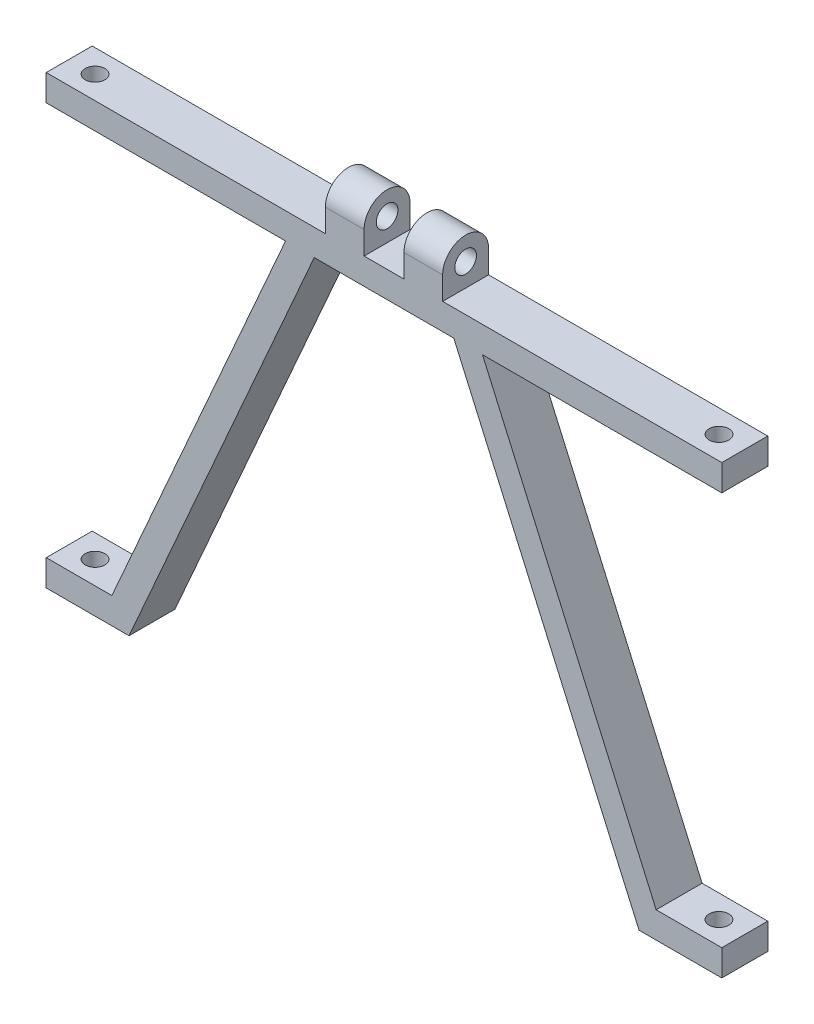
from build123d import *

# Parameters (mm, degrees)
SALIENTE_EXTRUIR3_DEPTH    = 7
CORTAR_EXTRUIR2_DEPTH      = 86.560604398
CORTAR_EXTRUIR2_DEPTH_BACK = 86.560604398
CROQUIS5_R                 = 1.5
CROQUIS6_R                 = 1.65
SALIENTE_EXTRUIR4_DEPTH    = 15
CROQUIS7_W                 = 6.07
CROQUIS7_H                 = 7
CORTAR_EXTRUIR3_DEPTH      = 86.560604398


with BuildPart() as part:
    # Croquis4 → Saliente-Extruir3 (new body)
    with BuildSketch(Plane.XY):
        Polygon((51.455, -4), (51.455, 0), (-51.455, 0), (-51.455, -4), (-15, -4), (-41.455, -64), (-51.455, -64), (-51.455, -68), (-38.847108579, -68), (-10.628441913, -4), (10.628441913, -4), (38.847108579, -68), (51.455, -68), (51.455, -64), (41.455, -64), (15, -4), align=None)
    extrude(amount=SALIENTE_EXTRUIR3_DEPTH)

    # Croquis5 → Cortar-Extruir2 (cut, two sides: drawn at the far end of the back side and taken through both)
    with BuildSketch(Plane(origin=(0, 0, 0), x_dir=(1, 0, 0), z_dir=(0, 1, 0)).offset(-CORTAR_EXTRUIR2_DEPTH_BACK)):
        with Locations((-47.525, -3.5)):
            Circle(CROQUIS5_R)
        with Locations((47.525, -3.5)):
            Circle(CROQUIS5_R)
    extrude(amount=CORTAR_EXTRUIR2_DEPTH + CORTAR_EXTRUIR2_DEPTH_BACK, mode=Mode.SUBTRACT)

    # Croquis6 → Saliente-Extruir4 (add, symmetric)
    with BuildSketch(Plane(origin=(0, 0, 0), x_dir=(0, 0, -1), z_dir=(1, 0, 0))):
        with BuildLine():
            Line((-7, 0), (0, 0))
            Line((0, 0), (0, 3.5))
            ThreePointArc((0, 3.5), (-3.5, 7), (-7, 3.5))
            Line((-7, 3.5), (-7, 0))
        make_face()
        with Locations((-3.5, 3.5)):
            Circle(CROQUIS6_R, mode=Mode.SUBTRACT)
    extrude(amount=SALIENTE_EXTRUIR4_DEPTH, both=True)

    # Croquis7 → Cortar-Extruir3 (cut, through all)
    with BuildSketch(Plane.XY.offset(7)):
        with Locations((-11.965, 3.5)):
            Rectangle(CROQUIS7_W, CROQUIS7_H)
        with Locations((11.965, 3.5)):
            Rectangle(CROQUIS7_W, CROQUIS7_H)
        with Locations((0, 3.5)):
            Rectangle(CROQUIS7_W, CROQUIS7_H)
    extrude(amount=-CORTAR_EXTRUIR3_DEPTH, mode=Mode.SUBTRACT)


solid = part.part
